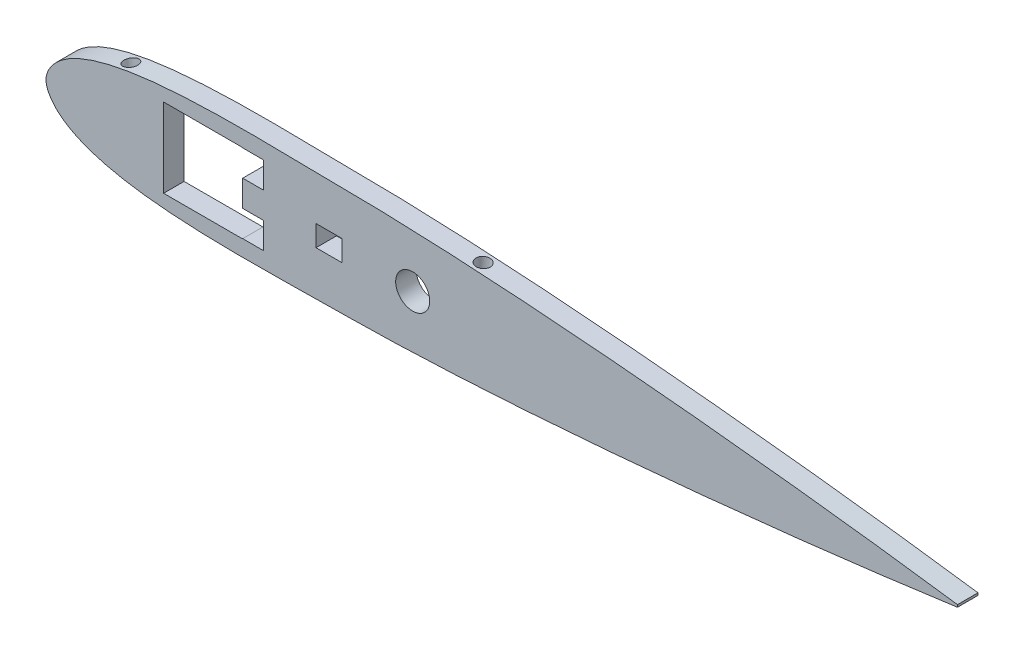
from build123d import *

# Parameters (mm, degrees)
BOSS_EXTRUDE2_DEPTH = 5.715
SCALE2_SCALE        = 0.87
SKETCH4_W           = 19.177
SKETCH4_H           = 19.177
CUT_EXTRUDE1_DEPTH  = 222.446604333
SKETCH9_R           = 4.1275
CUT_EXTRUDE2_DEPTH  = 222.446604333
SKETCH10_W          = 6.35
SKETCH10_H          = 5.08
SKETCH10_W_2        = 5.08
SKETCH10_H_2        = 6.35
CUT_EXTRUDE3_DEPTH  = 222.446604333


# Read off the part's stored shape, not the designer's step: Mirror1
with BuildPart() as part:
    # Sketch2 → Boss-Extrude2 (new body)
    with BuildSketch(Plane.XY):
        with BuildLine():
            Line((254, 0.32004), (254, -0.32004))
            add(Edge.make_bspline(
                [(254, 0.32004), (249.767631422, 0.903839201), (241.307291179, 2.070831107), (228.605373144, 3.690750774), (215.905231222, 5.229453163), (203.204539078, 6.675530537), (190.504313454, 8.039878015), (177.804260451, 9.32064365), (165.104460348, 10.514392622), (152.404191083, 11.606339724), (139.704381633, 12.598267516), (126.919607049, 13.472959141), (114.13521526, 14.221481743), (101.349465964, 14.775693136), (88.648632088, 15.185192204), (78.146386791, 15.178035247), (69.765668809, 15.373203718), (63.500254506, 15.460449009), (57.150055086, 15.506323834), (50.799339255, 15.478252184), (44.447830212, 15.346475062), (38.094548208, 15.078267108), (31.738441392, 14.620088359), (25.803106345, 13.959353637), (20.288821299, 13.055179709), (16.052048681, 12.090997742), (12.675404003, 11.07010546), (10.119694898, 10.136024937), (7.548966852, 8.96473462), (4.932712272, 7.430004121), (2.762461508, 5.635138845), (0.8510933, 3.232632286), (-0.555766099, 0), (0.8510933, -3.232632286), (2.762461508, -5.635138845), (4.932712272, -7.430004121), (7.548966852, -8.96473462), (10.119694898, -10.136024937), (12.675404003, -11.07010546), (16.052048681, -12.090997742), (20.288821299, -13.055179709), (25.803106345, -13.959353637), (31.738441392, -14.620088359), (38.094548208, -15.078267108), (44.447830212, -15.346475062), (50.799339255, -15.478252184), (57.150055086, -15.506323834), (63.500254506, -15.460449009), (69.765668809, -15.373203718), (78.146386791, -15.178035247), (88.648632088, -15.185192204), (101.349465964, -14.775693136), (114.13521526, -14.221481743), (126.919607049, -13.472959141), (139.704381633, -12.598267516), (152.404191083, -11.606339724), (165.104460348, -10.514392622), (177.804260451, -9.32064365), (190.504313454, -8.039878015), (203.204539078, -6.675530537), (215.905231222, -5.229453163), (228.605373144, -3.690750774), (241.307291179, -2.070831107), (249.767631422, -0.903839201), (254, -0.32004)],
                knots=[0, 0, 0, 0, 0.024634231, 0.04924287, 0.07382978, 0.098396751, 0.122945996, 0.147478562, 0.171994581, 0.196493552, 0.220976186, 0.245442093, 0.270380478, 0.294812969, 0.319231823, 0.343641967, 0.355360378, 0.36756608, 0.379770767, 0.391975369, 0.404182653, 0.416398684, 0.428636132, 0.440920171, 0.450818129, 0.460843203, 0.465945571, 0.471149096, 0.476522598, 0.482208155, 0.488618357, 0.492567758, 0.5, 0.507432242, 0.511381643, 0.517791845, 0.523477402, 0.528850904, 0.534054429, 0.539156797, 0.549181871, 0.559079829, 0.571363868, 0.583601316, 0.595817347, 0.608024631, 0.620229233, 0.63243392, 0.644639622, 0.656358033, 0.680768177, 0.705187031, 0.729619522, 0.754557907, 0.779023814, 0.803506448, 0.828005419, 0.852521438, 0.877054004, 0.901603249, 0.92617022, 0.95075713, 0.975365769, 1, 1, 1, 1], degree=3))
        make_face()
    extrude(amount=BOSS_EXTRUDE2_DEPTH)


with BuildPart() as part_1:
    # Scale2: scaled about (0, 0, 0)
    add(part.part.scale(SCALE2_SCALE))

    # Sketch4 → Cut-Extrude1 (cut, through all)
    with BuildSketch(Plane(origin=(0, 0, 0), x_dir=(-1, 0, 0), z_dir=(0, 0, -1))):
        with Locations((-38.1, 0)):
            Rectangle(SKETCH4_W, SKETCH4_H)
    extrude(amount=-CUT_EXTRUDE1_DEPTH, mode=Mode.SUBTRACT)

    # Sketch8 → Tap Drill for #8-32 Tap1 (revolve, cut)
    with BuildSketch(Plane(origin=(103.486489421, -12.119487853, 2.486025), x_dir=(0.9984192356585759, 0.056205247681556054, 0), z_dir=(0, 0, 1))):
        Polygon((0, 0), (0, 7.387806461), (1.7272, 6.35), (1.7272, 0), align=None)
    revolve(axis=Axis((103.843392744, -18.45945, 2.486025), (-0.05620524768155601, 0.9984192356585759, 0)), mode=Mode.SUBTRACT)

    # Sketch8 at point 2 (carried to point 2, square into its face) → Tap Drill for #8-32 Tap1 at 2 (revolve, cut)
    with BuildSketch(Plane(origin=(18.084281217, -11.394517714, 2.486025), x_dir=(0.982490425, -0.186313081, 0), z_dir=(0, 0, 1))):
        Polygon((0, 0), (0, 7.387806461), (1.7272, 6.35), (1.7272, 0), align=None)
    revolve(axis=Axis((16.901193154, -17.633331915, 2.486025), (0.186313081, 0.982490425, 0)), mode=Mode.SUBTRACT)

    # Mirror1 outline → Mirror1 (revolve, cut)
    with BuildSketch(Plane(origin=(19.542304665, 3.705872397, 2.486025), x_dir=(0.9824904519704877, 0.18631294047066896, 0), z_dir=(0, 0, -1))):
        Polygon((1.7272, -7.825671994), (1.7272, -1.475669249), (0, -0.437862788), (0, -7.825671994), align=None)
    revolve(axis=Axis((19.542304665, 3.705872397, 2.486025), (0.186312940470669, -0.9824904519704879, 0)), mode=Mode.SUBTRACT)

    # Mirror1 2 outline → Mirror1 2 (revolve, cut)
    with BuildSketch(Plane(origin=(102.479470477, -5.769003455, 2.486025), x_dir=(0.9984192356585759, -0.05620524768155611, 0), z_dir=(0, 0, 1))):
        Polygon((0, 10.529007108), (1.7272, 11.566813569), (1.7272, 17.91681357), (0, 17.91681357), align=None)
    revolve(axis=Axis((102.479470477, -5.769003455, 2.486025), (0.056205247681556124, 0.9984192356585762, 0)), mode=Mode.SUBTRACT)

    # Sketch9 → Cut-Extrude2 (cut, through all)
    with BuildSketch(Plane.XY):
        with Locations((88.9, 0)):
            Circle(SKETCH9_R)
    extrude(amount=CUT_EXTRUDE2_DEPTH, mode=Mode.SUBTRACT)

    # Sketch10 → Cut-Extrude3 (cut, through all)
    with BuildSketch(Plane(origin=(0, 0, 0), x_dir=(-1, 0, 0), z_dir=(0, 0, -1))):
        with Locations((-68.6435, 0)):
            Rectangle(SKETCH10_W, SKETCH10_H)
        with Locations((-50.2285, 6.35)):
            Rectangle(SKETCH10_W_2, SKETCH10_H_2)
        with Locations((-50.2285, -6.35)):
            Rectangle(SKETCH10_W_2, SKETCH10_H_2)
    extrude(amount=-CUT_EXTRUDE3_DEPTH, mode=Mode.SUBTRACT)


solid = part_1.part
